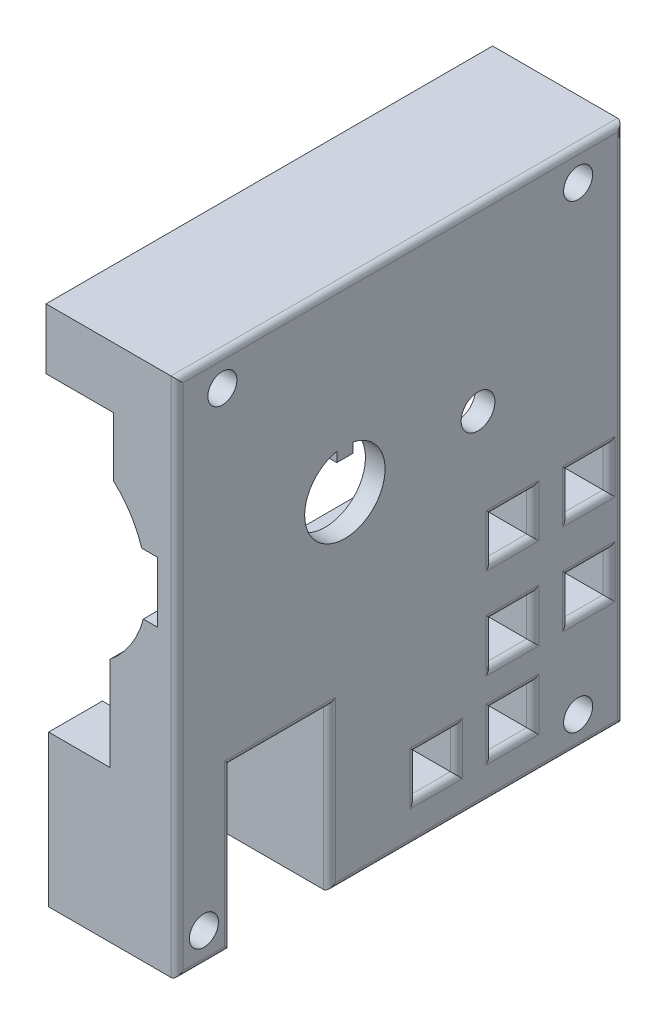
from build123d import *

# Parameters (mm, degrees)
PROFILEEXTRUDE_DEPTH = 73.76
HOSEWINDOW_W         = 16.29
HOSEWINDOW_H         = 26.5
HOSEWINDOWCUT_DEPTH  = 97.672784203
CAGESCREWS_R         = 2.4
CAGESCREWSCUT_DEPTH  = 97.672784203
AXLEHOLECUT_DEPTH    = 97.672784203
SETSCREWS_R          = 2.426338021
SETSCREWS_R_2        = 2.788762315
SETSCREWSCUT_DEPTH   = 97.67278428
SKETCH1_W            = 6.7
SKETCH1_H            = 6.7
CUT_EXTRUDE1_DEPTH   = 97.67278428
FILLET1_R            = 1


with BuildPart() as part:
    # Profile → ProfileExtrude (new body)
    with BuildSketch(Plane.XY):
        with BuildLine():
            Line((-6.01073477, -58.62791746), (-6.01073477, -33.62791746))
            Line((-6.01073477, -33.62791746), (4.13926523, -33.62791746))
            Line((4.13926523, -33.62791746), (4.13926523, -18.13791746))
            ThreePointArc((4.13926523, -18.13791746), (7.563334043, -14.326029686), (9.63126523, -9.63791746))
            Line((9.63126523, -9.63791746), (11.94926523, -9.63791746))
            Line((11.94926523, -9.63791746), (11.94926523, 0.36208254))
            Line((11.94926523, 0.36208254), (9.35926523, 0.36208254))
            ThreePointArc((9.35926523, 0.36208254), (7.525939238, 4.313848402), (4.70926523, 7.63708254))
            Line((4.70926523, 7.63708254), (4.70926523, 17.41208254))
            Line((4.70926523, 17.41208254), (-6.44073477, 17.41208254))
            Line((-6.44073477, 17.41208254), (-6.44073477, 27.41208254))
            Line((-6.44073477, 27.41208254), (15.18926523, 27.41208254))
            Line((15.18926523, 27.41208254), (15.18926523, -58.62791746))
            Line((15.18926523, -58.62791746), (-6.01073477, -58.62791746))
        make_face()
    extrude(amount=PROFILEEXTRUDE_DEPTH)

    # HoseWindow → HoseWindowCut (cut, through all)
    with BuildSketch(Plane(origin=(15.18926523, 0, 0), x_dir=(0, 0, -1), z_dir=(1, 0, 0))):
        with Locations((-56.725, -45.37791746)):
            Rectangle(HOSEWINDOW_W, HOSEWINDOW_H)
    extrude(amount=-HOSEWINDOWCUT_DEPTH, mode=Mode.SUBTRACT)

    # CageScrews → CageScrewsCut (cut, through all)
    with BuildSketch(Plane(origin=(15.18926523, 0, 0), x_dir=(0, 0, -1), z_dir=(1, 0, 0))):
        with Locations((-66.26, 22.41208254)):
            Circle(CAGESCREWS_R)
        with Locations((-7.5, 22.41208254)):
            Circle(CAGESCREWS_R)
        with Locations((-7.5, -53.62791746)):
            Circle(CAGESCREWS_R)
        with Locations((-69.31, -53.62791746)):
            Circle(CAGESCREWS_R)
    extrude(amount=-CAGESCREWSCUT_DEPTH, mode=Mode.SUBTRACT)

    # AxleHole → AxleHoleCut (cut, through all)
    with BuildSketch(Plane(origin=(15.18926523, 0, 0), x_dir=(0, 0, -1), z_dir=(1, 0, 0))):
        with BuildLine():
            Line((-44.699, 2.307293484), (-47.361, 2.307293484))
            Line((-47.361, 2.307293484), (-47.361, 3.926293484))
            ThreePointArc((-47.361, 3.926293484), (-46.03, -9.21691746), (-44.699, 3.926293484))
            Line((-44.699, 3.926293484), (-44.699, 2.307293484))
        make_face()
    extrude(amount=-AXLEHOLECUT_DEPTH, mode=Mode.SUBTRACT)

    # SetScrews → SetScrewsCut (cut, through all)
    with BuildSketch(Plane(origin=(15.18926523, 0, 0), x_dir=(0, 0, -1), z_dir=(1, 0, 0))):
        with Locations((-85.624962528, 3.100017238)):
            Circle(SETSCREWS_R)
        with Locations((-24.037149362, -2.017095907)):
            Circle(SETSCREWS_R_2)
    extrude(amount=-SETSCREWSCUT_DEPTH, mode=Mode.SUBTRACT)

    # Sketch1 → Cut-Extrude1 (cut, through all)
    with BuildSketch(Plane(origin=(15.18926523, 0, 0), x_dir=(0, 0, -1), z_dir=(1, 0, 0))):
        with Locations((-18.35, -48.92791746)):
            Rectangle(SKETCH1_W, SKETCH1_H)
        with Locations((-30.95, -48.92791746)):
            Rectangle(SKETCH1_W, SKETCH1_H)
        with Locations((-5.75, -36.22791746)):
            Rectangle(SKETCH1_W, SKETCH1_H)
        with Locations((-18.35, -36.22791746)):
            Rectangle(SKETCH1_W, SKETCH1_H)
        with Locations((-5.75, -21.22791746)):
            Rectangle(SKETCH1_W, SKETCH1_H)
        with Locations((-18.35, -21.22791746)):
            Rectangle(SKETCH1_W, SKETCH1_H)
    extrude(amount=-CUT_EXTRUDE1_DEPTH, mode=Mode.SUBTRACT)

    # Fillet1
    fillet1_edges = [part.edges().sort_by_distance(p)[0] for p in [
        (15.18926523, -48.92791746, 21.7),
        (15.18926523, -52.27791746, 18.35),
        (15.18926523, -48.92791746, 15),
        (15.18926523, -45.57791746, 18.35),
        (15.18926523, -58.62791746, 69.315),
        (15.18926523, -45.37791746, 64.87),
        (15.18926523, -32.12791746, 56.725),
        (15.18926523, -45.37791746, 48.58),
        (15.18926523, -58.62791746, 24.29),
        (15.18926523, -15.60791746, 0),
        (15.18926523, 27.41208254, 36.88),
        (15.18926523, -15.60791746, 73.76),
        (15.18926523, -24.57791746, 5.75),
        (15.18926523, -21.22791746, 2.4),
        (15.18926523, -17.87791746, 5.75),
        (15.18926523, -21.22791746, 9.1),
        (15.18926523, -21.22791746, 15),
        (15.18926523, -17.87791746, 18.35),
        (15.18926523, -21.22791746, 21.7),
        (15.18926523, -24.57791746, 18.35),
        (15.18926523, -39.57791746, 5.75),
        (15.18926523, -36.22791746, 2.4),
        (15.18926523, -32.87791746, 5.75),
        (15.18926523, -36.22791746, 9.1),
        (15.18926523, -36.22791746, 15),
        (15.18926523, -32.87791746, 18.35),
        (15.18926523, -36.22791746, 21.7),
        (15.18926523, -39.57791746, 18.35),
        (15.18926523, -52.27791746, 30.95),
        (15.18926523, -48.92791746, 27.6),
        (15.18926523, -45.57791746, 30.95),
        (15.18926523, -48.92791746, 34.3),
    ]]
    fillet(fillet1_edges, radius=FILLET1_R)


solid = part.part
